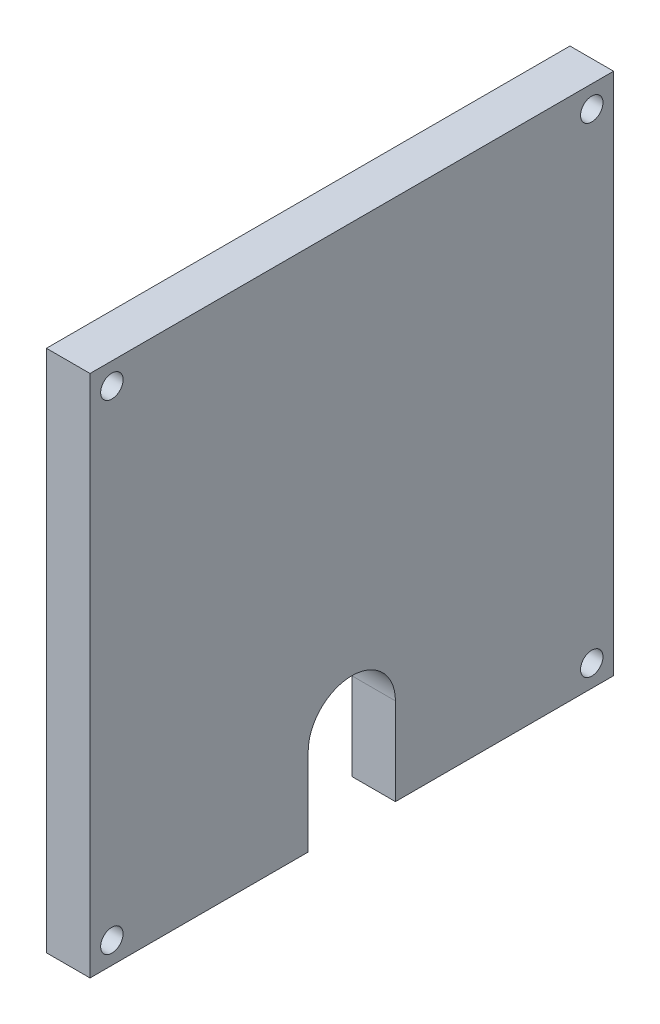
from build123d import *

# Parameters (mm, degrees)
SKETCH1_W                      = 76.2
SKETCH1_H                      = 76.2
BOSS_EXTRUDE1_DEPTH            = 6.35
F_4_CLEARANCE_HOLE1_D          = 3.2639
MIRROR2_COPY_1_D               = 3.2639
F_1_2_0_5_DIAMETER_SLOT1_DEPTH = 6.35


# Read off the part's stored shape, not the designer's step: 1/2 (0.5) Diameter Slot1
with BuildPart() as part:
    # Sketch1 → Boss-Extrude1 (new body)
    with BuildSketch(Plane(origin=(0, 0, 0), x_dir=(0, 0, -1), z_dir=(1, 0, 0))):
        Rectangle(SKETCH1_W, SKETCH1_H)
    extrude(amount=BOSS_EXTRUDE1_DEPTH)

    # #4 Clearance Hole1 (through all)
    with Locations(Plane(origin=(6.35, 0, 0), x_dir=(0, 0, -1), z_dir=(1, 0, 0))):
        with Locations((-34.925, 34.925)):
            f_4_clearance_hole1 = Hole(F_4_CLEARANCE_HOLE1_D / 2)

    # Mirror1: #4 Clearance Hole1 across plane
    add(f_4_clearance_hole1.mirror(Plane.XY), mode=Mode.SUBTRACT)

    # Mirror2: #4 Clearance Hole1 across plane
    add(f_4_clearance_hole1.mirror(Plane.ZX), mode=Mode.SUBTRACT)

    # Mirror2 copy 1 (through all)
    with Locations(Plane(origin=(6.35, 0, 0), x_dir=(0, 0, 1), z_dir=(1, 0, 0))):
        with Locations((-34.925, 34.925)):
            Hole(MIRROR2_COPY_1_D / 2)

    # 1/2 (0.5) Diameter Slot1 outline → 1/2 (0.5) Diameter Slot1 (cut)
    with BuildSketch(Plane.YZ):
        with BuildLine():
            ThreePointArc((-25.4, -6.35), (-19.05, 0), (-25.4, 6.35))
            Line((-25.4, 6.35), (-38.1, 6.35))
            Line((-38.1, 6.35), (-38.1, -6.35))
            Line((-38.1, -6.35), (-25.4, -6.35))
        make_face()
    extrude(amount=F_1_2_0_5_DIAMETER_SLOT1_DEPTH, mode=Mode.SUBTRACT)


solid = part.part
